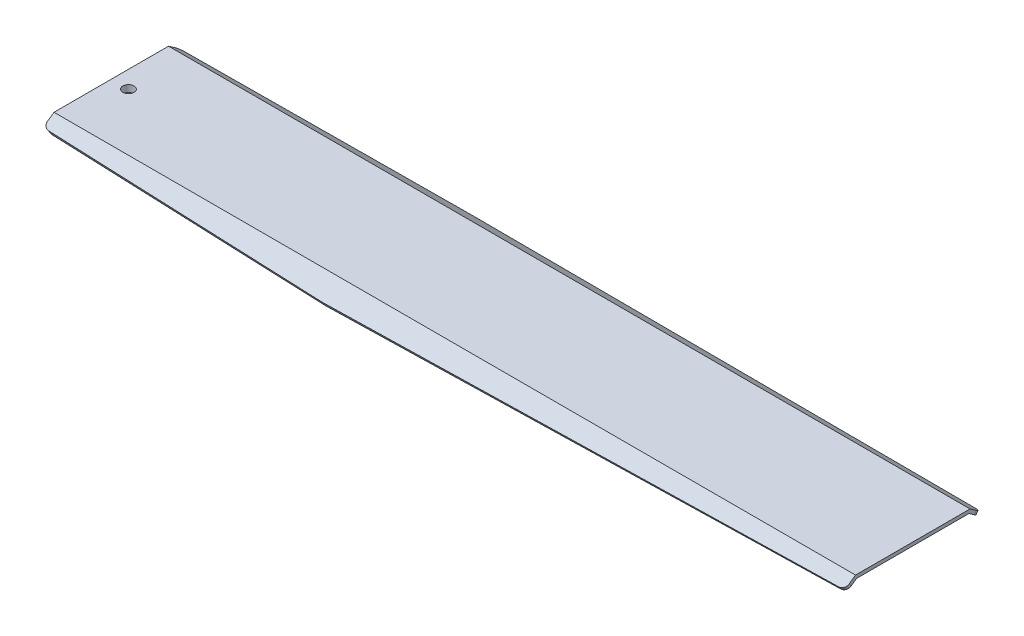
from build123d import *

# Parameters (mm, degrees)
BOSS_EXTRUDE1_DEPTH = 177.8
CUT_EXTRUDE2_REACH  = 182.717
CUT_LOFT2_DEPTH     = 6.207121586
CUT_LOFT2_DRAFT     = -55.0003318
CUT_EXTRUDE4_REACH  = 182.717
CUT_LOFT3_START     = -177.779804528
CUT_LOFT3_DEPTH     = 355.618213607
FILLET7_R           = 2.54
FILLET8_R           = 2.54
CUT_EXTRUDE5_REACH  = 183.056
SKETCH19_R          = 2.4765


# Read off the part's stored shape, not the designer's step: Cut-Loft2, Cut-Loft3
with BuildPart() as part:
    # Sketch1 → Boss-Extrude1 (new, symmetric)
    with BuildSketch(Plane(origin=(0, 0, 0), x_dir=(0, 0, -1), z_dir=(1, 0, 0))):
        Polygon((0, 3.048), (25.4, 3.048), (35.052, -3.710403159), (33.303739022, -6.20717859), (24.438969291, 0), (0, 0), align=None)
    boss_extrude1 = extrude(amount=BOSS_EXTRUDE1_DEPTH, both=True)

    # Sketch4 → Cut-Extrude2 (cut, up to next)
    with BuildSketch(Plane(origin=(0, 13.979334982, -9.788435734), x_dir=(1, 0, 0), z_dir=(0, 0.8191520442889915, -0.5735764363510467)), mode=Mode.PRIVATE) as cut_extrude2_sk1:
        Polygon((-177.8, 30.841117278), (177.8, 24.949659112), (177.8, 30.841117278), align=None)
    cut_extrude2_tool1 = extrude(cut_extrude2_sk1.sketch, amount=-CUT_EXTRUDE2_REACH, mode=Mode.PRIVATE) & part.part
    cut_extrude2 = cut_extrude2_tool1.solids().sort_by_distance((59.266667, -2.584003, -33.443333))[0]
    add(cut_extrude2, mode=Mode.SUBTRACT)


with BuildPart() as cut_loft2_tool:
    # Cut-Loft2 outline → Cut-Loft2 (with draft: the straight prism first)
    with BuildSketch(Plane(origin=(-0.003265654, 0.761986004, 0), x_dir=(0.9999908164530384, 0.0042856749276558815, 0), z_dir=(0.0042856749276558815, -0.9999908164530384, 0))):
        Polygon((177.804898534, -24.919484646), (177.804898534, 0), (-177.798367166, 0), (-177.798367166, -24.438969291), align=None)
    extrude(amount=CUT_LOFT2_DEPTH)
    # Cut-Loft2: the draft: its side faces are tilted about the plane it starts from
    cut_loft2_sides = [cut_loft2_tool.faces().sort_by_distance(p)[0] for p in [
        (177.813300853, -1.579532292, -12.459742323),
        (0.013300853, -2.341532292, 0),
        (-177.786699148, -3.103532292, -12.219484645),
        (0.013300853, -2.341532292, -24.679226969),
    ]]
    draft(cut_loft2_sides, Plane(origin=(-0.003265654, 0.761986004, 0), x_dir=(0.9999908164530384, 0.0042856749276558815, 0), z_dir=(0.0042856749276558815, -0.9999908164530384, 0)), CUT_LOFT2_DRAFT)


with BuildPart() as part_1:
    add(part.part)

    # Cut-Loft2: cut by cut_loft2_tool
    add(cut_loft2_tool.part, mode=Mode.SUBTRACT)

    # Cut-Extrude4: up to this plane
    cut_extrude4_end = Plane(origin=(177.8, -1.579589295, -29.351869511), z_dir=(0.00428567492765589, -0.819144521567724, 0.5735711688849072))
    # Sketch12 → Cut-Extrude4 (cut, up to the surface)
    with BuildSketch(Plane(origin=(0, 13.979334982, -9.788435734), x_dir=(1, 0, 0), z_dir=(0, 0.8191520442889914, -0.5735764363510467)), mode=Mode.PRIVATE) as cut_extrude4_sk1:
        Polygon((-177.8, 30.841117278), (-50.8, 28.737025076), (-177.8, 24.949659112), align=None)
    cut_extrude4_tool1 = split(extrude(cut_extrude4_sk1.sketch, amount=-CUT_EXTRUDE4_REACH, mode=Mode.PRIVATE), bisect_by=cut_extrude4_end, keep=Keep.BOTH, mode=Mode.PRIVATE)
    cut_extrude4 = cut_extrude4_tool1.solids().sort_by_distance((-135.466667, -2.181717, -32.86881))[0]
    add(cut_extrude4, mode=Mode.SUBTRACT)

    # Mirror20: Boss-Extrude1 across plane
    add(boss_extrude1.mirror(Plane.XY))

    # Cut-Loft3 outline → Cut-Loft3 (cut)
    with BuildSketch(Plane(origin=(0, 0, 0), x_dir=(-0.004285667102275099, 0.999990816469807, -5.791138486653598e-06), z_dir=(0.9999899034999146, 0.0042856710149996365, 0.0013512668805631468)).offset(CUT_LOFT3_START)):
        Polygon((0.762004584, -2), (0.761850081, 24.679204437), (-5.720934875, 33.93758085), (-6.464848773, 35), (-8, 35), (-8, -2), align=None)
    extrude(amount=CUT_LOFT3_DEPTH, mode=Mode.SUBTRACT)

    # Mirror21: Cut-Extrude4 across plane
    add(cut_extrude4.mirror(Plane.XY), mode=Mode.SUBTRACT)

    # Mirror22: Cut-Extrude2 across plane
    add(cut_extrude2.mirror(Plane.XY), mode=Mode.SUBTRACT)

    # Fillet7
    fillet7_edges = [part_1.edges().sort_by_distance(p)[0] for p in [
        (-177.8, -1.579589295, -29.351869511),
        (-177.8, -1.579589295, 29.351869511),
    ]]
    fillet(fillet7_edges, radius=FILLET7_R)

    # Fillet8
    fillet8_edges = [part_1.edges().sort_by_distance(p)[0] for p in [
        (177.8, -0.955395437, -29.788934755),
        (177.8, -0.955395437, 29.788934755),
    ]]
    fillet(fillet8_edges, radius=FILLET8_R)

    # Cut-Extrude5: up to this plane
    cut_extrude5_end = Plane(origin=(177.8, 1.524, -24.919484646), z_dir=(0.004285674927655877, -0.9999908164530384, 0))
    # Sketch19 → Cut-Extrude5 (cut, up to the surface)
    with BuildSketch(Plane(origin=(0, 3.048, 0), x_dir=(1, 0, 0), z_dir=(0, 1, 0)), mode=Mode.PRIVATE) as cut_extrude5_sk1:
        with Locations(Location((-170.18, 0, 0), (0, 0, 270))):
            Circle(SKETCH19_R)
    cut_extrude5_tool1 = split(extrude(cut_extrude5_sk1.sketch, amount=-CUT_EXTRUDE5_REACH, mode=Mode.PRIVATE), bisect_by=cut_extrude5_end, keep=Keep.BOTH, mode=Mode.PRIVATE)
    add(cut_extrude5_tool1.solids().sort_by_distance((-170.18, 3.048, 0))[0], mode=Mode.SUBTRACT)


solid = part_1.part
